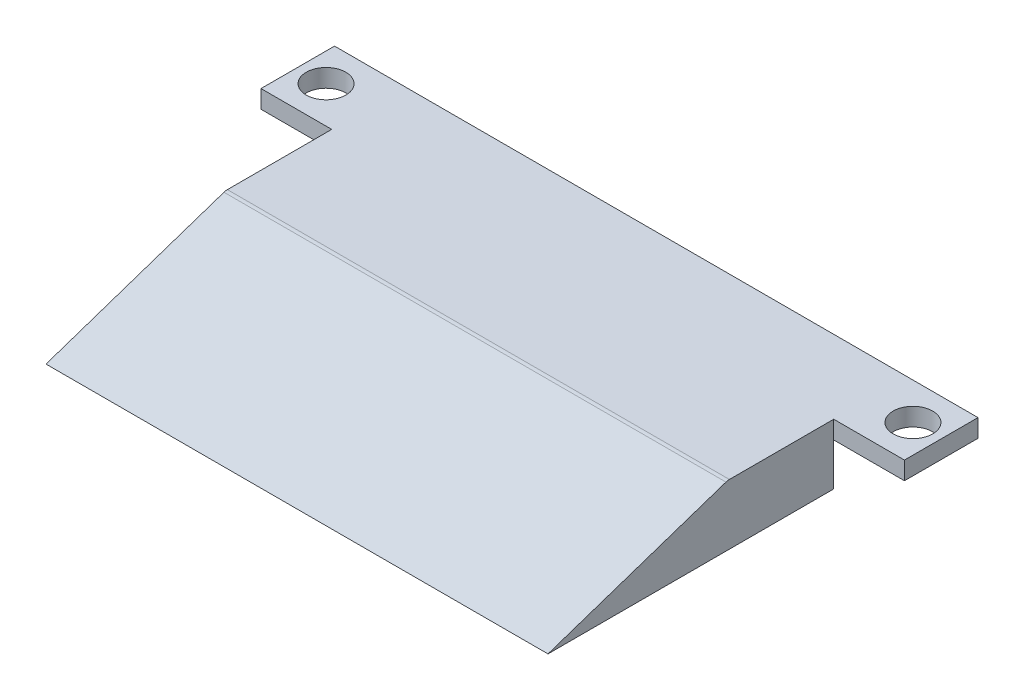
from build123d import *

# Parameters (mm, degrees)
SKETCH2_W           = 454.914
SKETCH2_H           = 254
BOSS_EXTRUDE2_DEPTH = 42.7
SKETCH5_W           = 50
SKETCH5_H           = 202
CUT_EXTRUDE2_DEPTH  = 523.767670573
SKETCH6_R           = 14
CUT_EXTRUDE3_DEPTH  = 523.767670573
CUT_EXTRUDE4_DEPTH  = 480.890234737
FILLET1_R           = 7.62
SKETCH8_W           = 52
SKETCH8_H           = 30
CUT_EXTRUDE5_DEPTH  = 523.767670573


with BuildPart() as part:
    # Sketch2 → Boss-Extrude2 (new body)
    with BuildSketch(Plane(origin=(0, 0, 0), x_dir=(1, 0, 0), z_dir=(0, 1, 0))):
        with Locations((227.457, 127)):
            Rectangle(SKETCH2_W, SKETCH2_H)
    extrude(amount=BOSS_EXTRUDE2_DEPTH)

    # Sketch5 → Cut-Extrude2 (cut, through all)
    with BuildSketch(Plane(origin=(0, 42.7, 0), x_dir=(1, 0, 0), z_dir=(0, 1, 0))):
        with Locations((25, 101)):
            Rectangle(SKETCH5_W, SKETCH5_H)
        with Locations((429.914, 101)):
            Rectangle(SKETCH5_W, SKETCH5_H)
    extrude(amount=-CUT_EXTRUDE2_DEPTH, mode=Mode.SUBTRACT)

    # Sketch6 → Cut-Extrude3 (cut, through all)
    with BuildSketch(Plane(origin=(0, 42.7, 0), x_dir=(1, 0, 0), z_dir=(0, 1, 0))):
        with Locations((434.914, 228)):
            Circle(SKETCH6_R)
        with Locations((20, 228)):
            Circle(SKETCH6_R)
    extrude(amount=-CUT_EXTRUDE3_DEPTH, mode=Mode.SUBTRACT)

    # Sketch7 → Cut-Extrude4 (cut, through all)
    with BuildSketch(Plane(origin=(404.914, 0, 0), x_dir=(0, 0, -1), z_dir=(1, 0, 0))):
        Polygon((0, 42.7), (127, 42.7), (0, 0), align=None)
    extrude(amount=-CUT_EXTRUDE4_DEPTH, mode=Mode.SUBTRACT)

    # Fillet1
    fillet1_edges = [part.edges().sort_by_distance(p)[0] for p in [
        (227.457, 42.7, -127),
    ]]
    fillet(fillet1_edges, radius=FILLET1_R)

    # Sketch8 → Cut-Extrude5 (cut, through all)
    with BuildSketch(Plane(origin=(454.914, 0, 0), x_dir=(0, 0, -1), z_dir=(1, 0, 0))):
        with Locations((228, 15)):
            Rectangle(SKETCH8_W, SKETCH8_H)
    extrude(amount=-CUT_EXTRUDE5_DEPTH, mode=Mode.SUBTRACT)


solid = part.part
